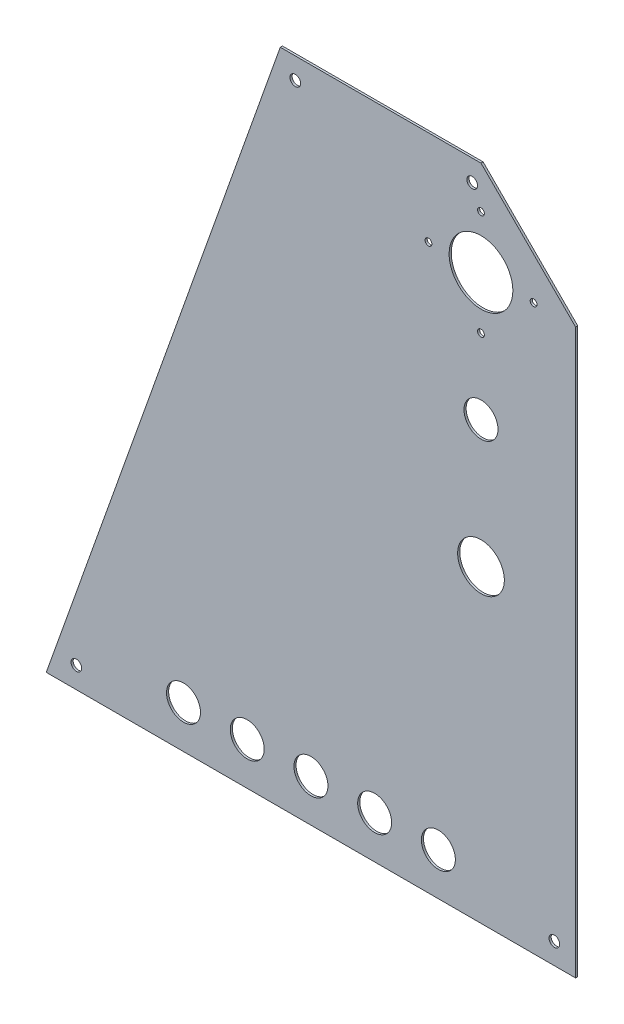
from build123d import *

# Parameters (mm, degrees)
SKETCH1_W           = 310
SKETCH1_H           = 250
BOSS_EXTRUDE1_DEPTH = 1
SKETCH2_OUTSIDE_W   = 391.65
SKETCH2_OUTSIDE_H   = 331.65
CUT_EXTRUDE1_DEPTH  = 200.125588511
SKETCH3_R           = 15
SKETCH3_R_2         = 8
SKETCH3_R_3         = 11
SKETCH3_R_4         = 1.6
CUT_EXTRUDE2_DEPTH  = 200.125588511
SKETCH4_R           = 8
CUT_EXTRUDE3_DEPTH  = 200.125588511
SKETCH5_R           = 2.5
CUT_EXTRUDE4_DEPTH  = 200.125588511


with BuildPart() as part:
    # Sketch1 → Boss-Extrude1 (new body)
    with BuildSketch(Plane(origin=(0, 0, 0), x_dir=(0, 1, 0), z_dir=(0, 0, 1))):
        Rectangle(SKETCH1_W, SKETCH1_H)
    extrude(amount=BOSS_EXTRUDE1_DEPTH)

    # Sketch2 outside → Cut-Extrude1 (cut, through all)
    with BuildSketch(Plane(origin=(0, 0, 1), x_dir=(0, -1, 0), z_dir=(0, 0, 1))):
        Rectangle(SKETCH2_OUTSIDE_W, SKETCH2_OUTSIDE_H)
        Polygon((-155, -14.047727215), (155, -124.233933248), (155, 125), (-110.452272785, 125), (-155, 80.452272785), align=None, mode=Mode.SUBTRACT)
    extrude(amount=-CUT_EXTRUDE1_DEPTH, mode=Mode.SUBTRACT)

    # Sketch3 → Cut-Extrude2 (cut, through all)
    with BuildSketch(Plane(origin=(0, 0, 1), x_dir=(0, -1, 0), z_dir=(0, 0, 1))):
        with Locations((-110.452272785, 80.452272785)):
            Circle(SKETCH3_R)
        with Locations((-50.452272785, 80.452272785)):
            Circle(SKETCH3_R_2)
        with Locations((9.547727215, 80.452272785)):
            Circle(SKETCH3_R_3)
        with Locations((-110.452272785, 55.703535444)):
            Circle(SKETCH3_R_4)
        with Locations((-135.201010127, 80.452272785)):
            Circle(SKETCH3_R_4)
        with Locations((-110.452272785, 105.201010127)):
            Circle(SKETCH3_R_4)
        with Locations((-85.703535444, 80.452272785)):
            Circle(SKETCH3_R_4)
    extrude(amount=-CUT_EXTRUDE2_DEPTH, mode=Mode.SUBTRACT)

    # Sketch4 → Cut-Extrude3 (cut, through all)
    with BuildSketch(Plane(origin=(0, 0, 1), x_dir=(0, -1, 0), z_dir=(0, 0, 1))):
        with Locations((135, -59.616966624)):
            Circle(SKETCH4_R)
        with Locations((135, -29.616966624)):
            Circle(SKETCH4_R)
        with Locations((135, 0.383033376)):
            Circle(SKETCH4_R)
        with Locations((135, 30.383033376)):
            Circle(SKETCH4_R)
        with Locations((135, 60.383033376)):
            Circle(SKETCH4_R)
    extrude(amount=-CUT_EXTRUDE3_DEPTH, mode=Mode.SUBTRACT)

    # Sketch5 → Cut-Extrude4 (cut, through all)
    with BuildSketch(Plane(origin=(0, 0, 1), x_dir=(0, -1, 0), z_dir=(0, 0, 1))):
        with Locations((145, -110.066636279)):
            Circle(SKETCH5_R)
        with Locations((-145, -6.989217732)):
            Circle(SKETCH5_R)
        with Locations((-145, 76.310137162)):
            Circle(SKETCH5_R)
        with Locations((145, 115)):
            Circle(SKETCH5_R)
    extrude(amount=-CUT_EXTRUDE4_DEPTH, mode=Mode.SUBTRACT)


solid = part.part
